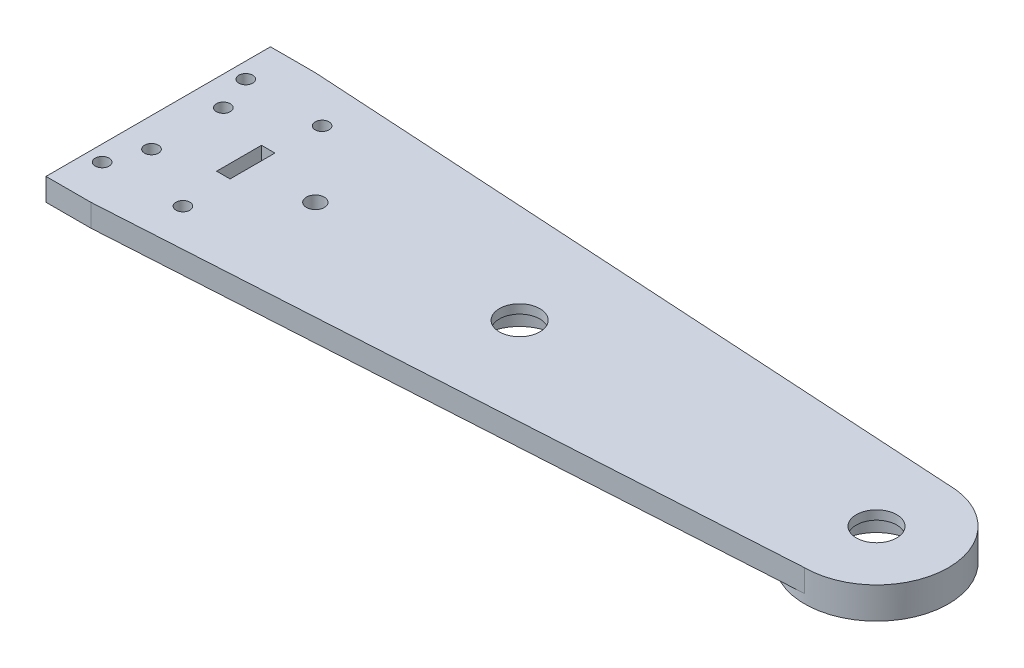
from build123d import *
from build123d.topology import SkipClean

# Parameters (mm, degrees)
SKETCH28_R           = 1.55
SKETCH28_R_2         = 4.5
SKETCH28_R_3         = 2
SKETCH28_W           = 10
SKETCH28_H           = 3
BOSS_EXTRUDE10_DEPTH = 5
SKETCH29_R           = 16
BOSS_EXTRUDE11_DEPTH = 2
SKETCH30_R           = 8.2
CUT_EXTRUDE1_DEPTH   = 5


with BuildPart() as part:
    # Sketch28 → Boss-Extrude10 (new body)
    with BuildSketch(Plane(origin=(-32, 0, 0), x_dir=(0, 0, 1), z_dir=(0, -1, 0))):
        with BuildLine():
            Line((-25, 15), (25, 15))
            Line((25, 15), (25, 5))
            Line((25, 5), (16, -145))
            ThreePointArc((16, -145), (0, -161), (-16, -145))
            Line((-16, -145), (-25, 5))
            Line((-25, 5), (-25, 15))
        make_face()
        with Locations((8, 8.5)):
            Circle(SKETCH28_R, mode=Mode.SUBTRACT)
        with Locations((-8, 8.5)):
            Circle(SKETCH28_R, mode=Mode.SUBTRACT)
        with Locations((16, 11.5)):
            Circle(SKETCH28_R, mode=Mode.SUBTRACT)
        with Locations((-16, 11.5)):
            Circle(SKETCH28_R, mode=Mode.SUBTRACT)
        with Locations((-15.5, -6)):
            Circle(SKETCH28_R, mode=Mode.SUBTRACT)
        with Locations((15.5, -6)):
            Circle(SKETCH28_R, mode=Mode.SUBTRACT)
        with Locations((0, -65.5)):
            Circle(SKETCH28_R_2, mode=Mode.SUBTRACT)
        with Locations((0, -20)):
            Circle(SKETCH28_R_3, mode=Mode.SUBTRACT)
        with Locations((0, -145)):
            Circle(SKETCH28_R_2, mode=Mode.SUBTRACT)
        with Locations((0, -4.5)):
            Rectangle(SKETCH28_W, SKETCH28_H, mode=Mode.SUBTRACT)
    extrude(amount=BOSS_EXTRUDE10_DEPTH)

    # Sketch29 → Boss-Extrude11 (add)
    with SkipClean():  # the faces are left unmerged after this step: merging them gives an invalid solid
        with BuildSketch(Plane.XZ.offset(5)):
            with Locations((33.5, 0)):
                Circle(SKETCH29_R)
            with Locations((113, 0)):
                Circle(SKETCH29_R)
        extrude(amount=BOSS_EXTRUDE11_DEPTH)
    add(part.part.scale(1), mode=Mode.REPLACE)  # the faces are merged on a copy

    # Sketch30 → Cut-Extrude1 (cut)
    with BuildSketch(Plane.XZ.offset(7)):
        with Locations((33.5, 0)):
            Circle(SKETCH30_R)
        with Locations((113, 0)):
            Circle(SKETCH30_R)
    extrude(amount=-CUT_EXTRUDE1_DEPTH, mode=Mode.SUBTRACT)


solid = part.part
